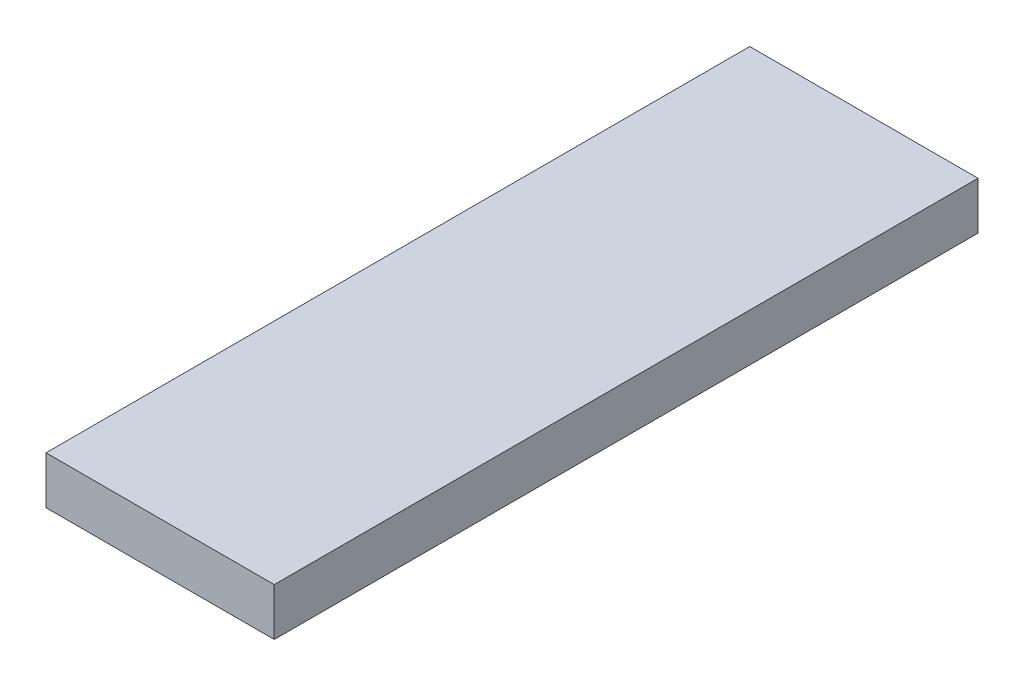
from build123d import *

# Parameters (mm, degrees)
SKETCH1_W           = 12
SKETCH1_H           = 37
BOSS_EXTRUDE1_DEPTH = 2.5


with BuildPart() as part:
    # Sketch1 → Boss-Extrude1 (new body)
    with BuildSketch(Plane(origin=(0, 0, 0), x_dir=(1, 0, 0), z_dir=(0, 1, 0))):
        with Locations((18.548076923, 7.969230769)):
            Rectangle(SKETCH1_W, SKETCH1_H)
    extrude(amount=BOSS_EXTRUDE1_DEPTH)


solid = part.part
